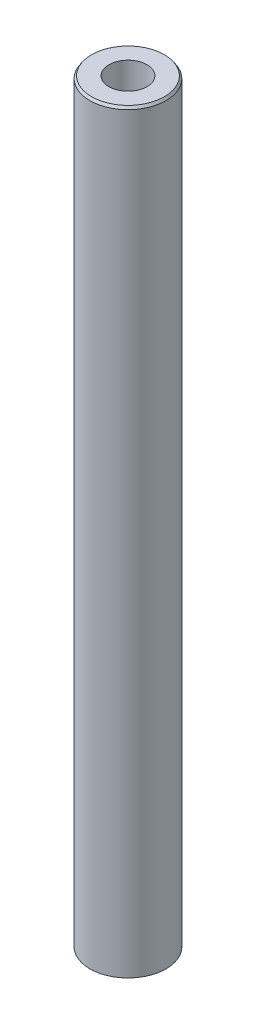
from build123d import *
from OCP.BRepFilletAPI import BRepFilletAPI_MakeChamfer

# Parameters (mm, degrees)
SKETCH1_R           = 12.5
BOSS_EXTRUDE1_DEPTH = 248.153610692
SKETCH2_R           = 6.248469623
CUT_EXTRUDE1_DEPTH  = 249.782464212
CHAMFER1_SIZE       = 0.82866288
CHAMFER1_SIZE2      = 0.560851096


with BuildPart() as part:
    # Sketch1 → Boss-Extrude1 (new body)
    with BuildSketch(Plane(origin=(0, 0, 0), x_dir=(1, 0, 0), z_dir=(0, 1, 0))):
        Circle(SKETCH1_R)
    extrude(amount=BOSS_EXTRUDE1_DEPTH)

    # Sketch2 → Cut-Extrude1 (cut, through all)
    with BuildSketch(Plane(origin=(0, 0, 0), x_dir=(1, 0, 0), z_dir=(0, 1, 0))):
        Circle(SKETCH2_R)
    extrude(amount=CUT_EXTRUDE1_DEPTH, mode=Mode.SUBTRACT)

    # Chamfer1: one chamfer whose edges measure the first distance from different faces: ONE call of the kernel's chamfer builder (chamfer() names one face for all edges)
    chamfer1_edges_1 = [part.edges().sort_by_distance(p)[0] for p in [
        (-12.5, 248.153610692, 0),
    ]]
    chamfer1_side_1 = [part.faces().sort_by_distance(p)[0] for p in [
        (-12.5, 124.076805346, 0),
    ]]
    chamfer1_edges_2 = [part.edges().sort_by_distance(p)[0] for p in [
        (-12.5, 0, 0),
    ]]
    chamfer1_side_2 = [part.faces().sort_by_distance(p)[0] for p in [
        (-12.146446609, 0, 0),
    ]]
    chamfer1 = BRepFilletAPI_MakeChamfer(part.part.solid().wrapped)
    for e in chamfer1_edges_1:
        chamfer1.Add(CHAMFER1_SIZE, CHAMFER1_SIZE2, e.wrapped, chamfer1_side_1[0].wrapped)  # the first distance lies on this face
    for e in chamfer1_edges_2:
        chamfer1.Add(CHAMFER1_SIZE, CHAMFER1_SIZE2, e.wrapped, chamfer1_side_2[0].wrapped)  # the first distance lies on this face
    add(Compound.cast(chamfer1.Shape()), mode=Mode.REPLACE)


solid = part.part
